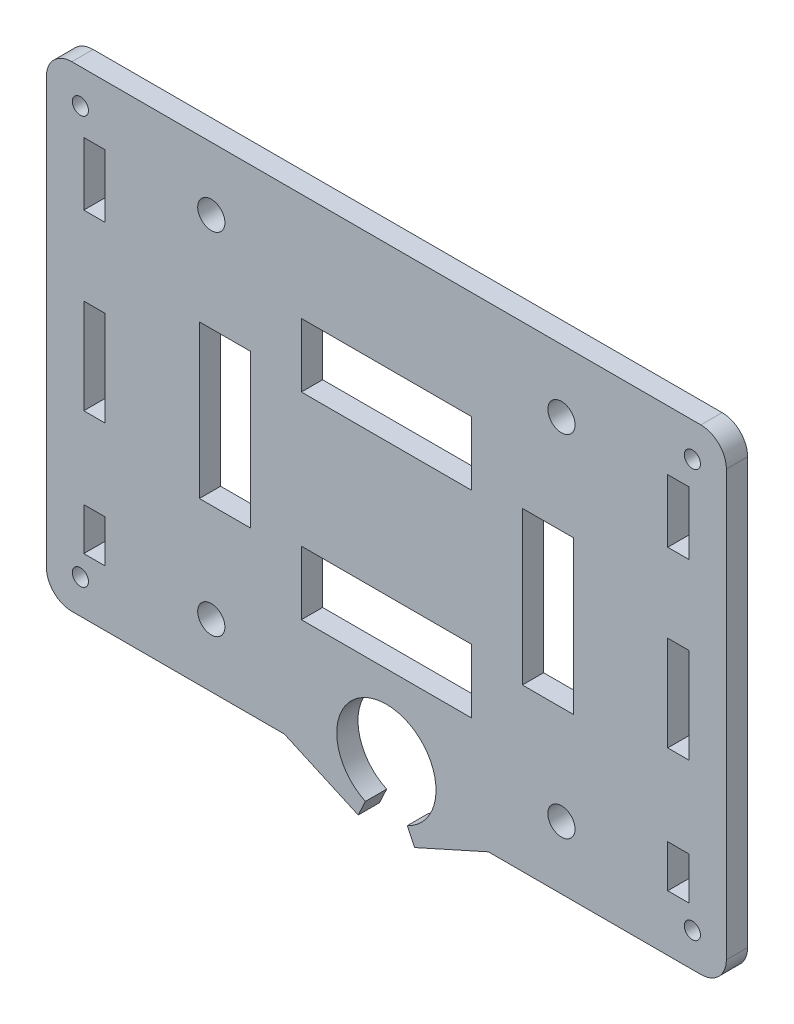
from build123d import *

# Parameters (mm, degrees)
SKETCH1_R           = 0.60325
SKETCH1_W           = 1.5875
SKETCH1_H           = 3.175
SKETCH1_R_2         = 1.016
SKETCH1_W_2         = 12.7
SKETCH1_H_2         = 4.7625
SKETCH1_H_3         = 7.0993
SKETCH1_W_3         = 3.81
SKETCH1_H_4         = 11.43
SKETCH1_H_5         = 4.699
BOSS_EXTRUDE1_DEPTH = 1.5875


with BuildPart() as part:
    # Sketch1 → Boss-Extrude1 (new body)
    with BuildSketch(Plane.XY):
        with BuildLine():
            ThreePointArc((25.4, 15.875), (24.842038418, 17.222038418), (23.495, 17.78))
            Line((23.495, 17.78), (-23.495, 17.78))
            ThreePointArc((-23.495, 17.78), (-24.842038418, 17.222038418), (-25.4, 15.875))
            Line((-25.4, 15.875), (-25.4, -15.875))
            ThreePointArc((-25.4, -15.875), (-24.842038418, -17.222038418), (-23.495, -17.78))
            Line((-23.495, -17.78), (-7.62, -17.78))
            Line((-7.62, -17.78), (-2.103962754, -20.259962687))
            Line((-2.103962754, -20.259962687), (-1.567237562, -19.108951797))
            ThreePointArc((-1.567237562, -19.108951797), (0, -12.0396), (1.567237562, -19.108951797))
            Line((1.567237562, -19.108951797), (2.103962754, -20.259962687))
            Line((2.103962754, -20.259962687), (7.62, -17.78))
            Line((7.62, -17.78), (23.495, -17.78))
            ThreePointArc((23.495, -17.78), (24.842038418, -17.222038418), (25.4, -15.875))
            Line((25.4, -15.875), (25.4, 15.875))
        make_face()
        with Locations((-22.86, -15.24)):
            Circle(SKETCH1_R, mode=Mode.SUBTRACT)
        with Locations((-21.81225, -12.011129894)):
            Rectangle(SKETCH1_W, SKETCH1_H, mode=Mode.SUBTRACT)
        with Locations((-13.08, -13.08)):
            Circle(SKETCH1_R_2, mode=Mode.SUBTRACT)
        with Locations((13.08, -13.08)):
            Circle(SKETCH1_R_2, mode=Mode.SUBTRACT)
        with Locations((22.86, -15.24)):
            Circle(SKETCH1_R, mode=Mode.SUBTRACT)
        with Locations((21.81225, -12.011129894)):
            Rectangle(SKETCH1_W, SKETCH1_H, mode=Mode.SUBTRACT)
        with Locations((0, -7.366)):
            Rectangle(SKETCH1_W_2, SKETCH1_H_2, mode=Mode.SUBTRACT)
        with Locations((-21.81225, -0.80645)):
            Rectangle(SKETCH1_W, SKETCH1_H_3, mode=Mode.SUBTRACT)
        with Locations((-12.065, 0)):
            Rectangle(SKETCH1_W_3, SKETCH1_H_4, mode=Mode.SUBTRACT)
        with Locations((-21.81225, 10.975870106)):
            Rectangle(SKETCH1_W, SKETCH1_H_5, mode=Mode.SUBTRACT)
        with Locations((-22.86, 15.24)):
            Circle(SKETCH1_R, mode=Mode.SUBTRACT)
        with Locations((-13.08, 13.08)):
            Circle(SKETCH1_R_2, mode=Mode.SUBTRACT)
        with Locations((12.065, 0)):
            Rectangle(SKETCH1_W_3, SKETCH1_H_4, mode=Mode.SUBTRACT)
        with Locations((0, 7.366)):
            Rectangle(SKETCH1_W_2, SKETCH1_H_2, mode=Mode.SUBTRACT)
        with Locations((21.81225, -0.80645)):
            Rectangle(SKETCH1_W, SKETCH1_H_3, mode=Mode.SUBTRACT)
        with Locations((21.81225, 10.975870106)):
            Rectangle(SKETCH1_W, SKETCH1_H_5, mode=Mode.SUBTRACT)
        with Locations((13.08, 13.08)):
            Circle(SKETCH1_R_2, mode=Mode.SUBTRACT)
        with Locations((22.86, 15.24)):
            Circle(SKETCH1_R, mode=Mode.SUBTRACT)
    extrude(amount=BOSS_EXTRUDE1_DEPTH)


solid = part.part
